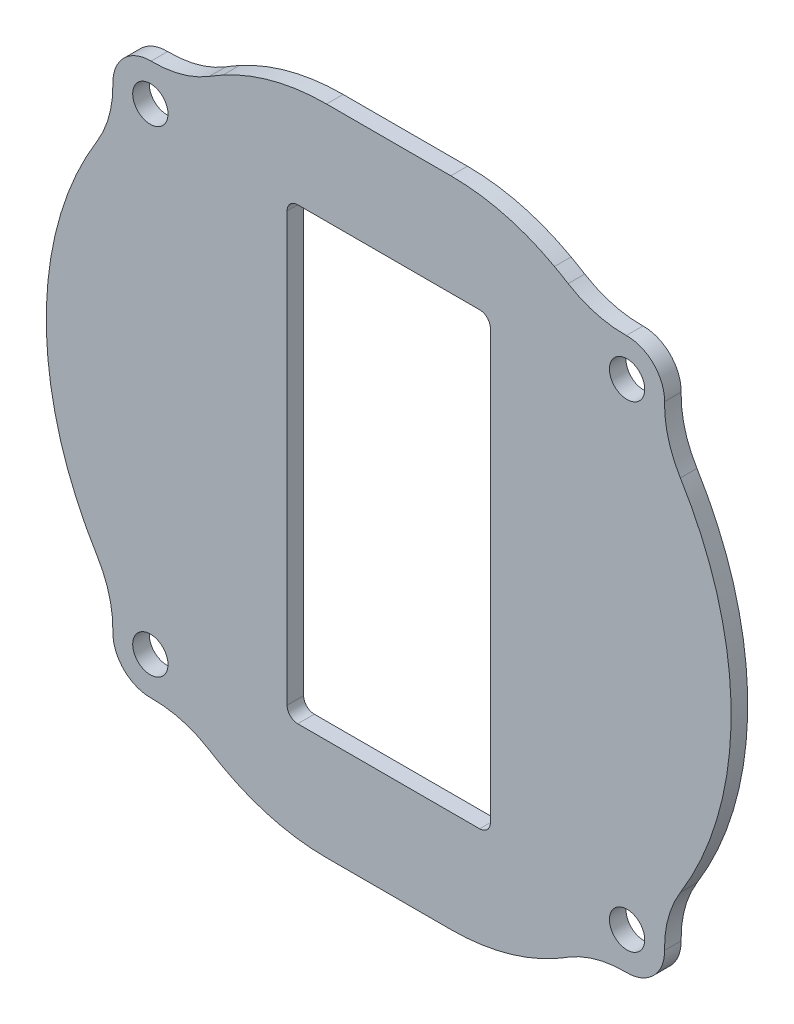
from build123d import *

# Parameters (mm, degrees)
ESQUISSE1_R             = 1.65
BOSS_EXTRU_1_DEPTH      = 1.55
ESQUISSE2_W             = 19
ESQUISSE2_H             = 42
ENL_V_MAT_EXTRU_1_DEPTH = 46.281370341
CONG_1_R                = 10
CONG_2_R                = 1
ESQUISSE3_OUTSIDE_W     = 84.104
ESQUISSE3_OUTSIDE_H     = 84.104
ESQUISSE3_OUTSIDE_W_2   = 70
ESQUISSE3_OUTSIDE_H_2   = 61
ENL_V_MAT_EXTRU_2_DEPTH = 46.281370486
CONG_3_R                = 20


with BuildPart() as part:
    # Esquisse1 → Boss.-Extru.1 (new body)
    with BuildSketch(Plane.XY):
        with BuildLine():
            ThreePointArc((-24.957906965, 20.02755302), (-32, 0), (-24.957906965, -20.02755302))
            ThreePointArc((-24.957906965, -20.02755302), (-24.748737342, -24.748737342), (-20.02755302, -24.957906965))
            ThreePointArc((-20.02755302, -24.957906965), (0, -32), (20.02755302, -24.957906965))
            ThreePointArc((20.02755302, -24.957906965), (24.748737342, -24.748737342), (24.957906965, -20.02755302))
            ThreePointArc((24.957906965, -20.02755302), (32, 0), (24.957906965, 20.02755302))
            ThreePointArc((24.957906965, 20.02755302), (24.748737342, 24.748737342), (20.02755302, 24.957906965))
            ThreePointArc((20.02755302, 24.957906965), (0, 32), (-20.02755302, 24.957906965))
            ThreePointArc((-20.02755302, 24.957906965), (-24.748737342, 24.748737342), (-24.957906965, 20.02755302))
        make_face()
        with Locations((-22.273863607, 22.273863607)):
            Circle(ESQUISSE1_R, mode=Mode.SUBTRACT)
        with Locations((22.273863607, 22.273863607)):
            Circle(ESQUISSE1_R, mode=Mode.SUBTRACT)
        with Locations((22.273863607, -22.273863607)):
            Circle(ESQUISSE1_R, mode=Mode.SUBTRACT)
        with Locations((-22.273863607, -22.273863607)):
            Circle(ESQUISSE1_R, mode=Mode.SUBTRACT)
    extrude(amount=BOSS_EXTRU_1_DEPTH)

    # Esquisse2 → Enlèv. mat.-Extru.1 (cut, through all)
    with BuildSketch(Plane.XY.offset(1.55)):
        Rectangle(ESQUISSE2_W, ESQUISSE2_H)
    extrude(amount=-ENL_V_MAT_EXTRU_1_DEPTH, mode=Mode.SUBTRACT)

    # Congé1
    cong_1_edges = [part.edges().sort_by_distance(p)[0] for p in [
        (24.957906965, -20.02755302, 0.775),
        (20.02755302, -24.957906965, 0.775),
        (-20.02755302, -24.957906965, 0.775),
        (-24.957906965, -20.02755302, 0.775),
        (-24.957906965, 20.02755302, 0.775),
        (-20.02755302, 24.957906965, 0.775),
        (20.02755302, 24.957906965, 0.775),
        (24.957906965, 20.02755302, 0.775),
    ]]
    fillet(cong_1_edges, radius=CONG_1_R)

    # Congé2
    cong_2_edges = [part.edges().sort_by_distance(p)[0] for p in [
        (9.5, 21, 0.775),
        (9.5, -21, 0.775),
        (-9.5, -21, 0.775),
        (-9.5, 21, 0.775),
    ]]
    fillet(cong_2_edges, radius=CONG_2_R)

    # Esquisse3 outside → Enlèv. mat.-Extru.2 (cut, through all)
    with BuildSketch(Plane.XY.offset(1.55)):
        Rectangle(ESQUISSE3_OUTSIDE_W, ESQUISSE3_OUTSIDE_H)
        Rectangle(ESQUISSE3_OUTSIDE_W_2, ESQUISSE3_OUTSIDE_H_2, mode=Mode.SUBTRACT)
    extrude(amount=-ENL_V_MAT_EXTRU_2_DEPTH, mode=Mode.SUBTRACT)

    # Congé3
    cong_3_edges = [part.edges().sort_by_distance(p)[0] for p in [
        (9.682458366, -30.5, 0.775),
        (-9.682458366, -30.5, 0.775),
        (9.682458366, 30.5, 0.775),
        (-9.682458366, 30.5, 0.775),
    ]]
    fillet(cong_3_edges, radius=CONG_3_R)


solid = part.part
